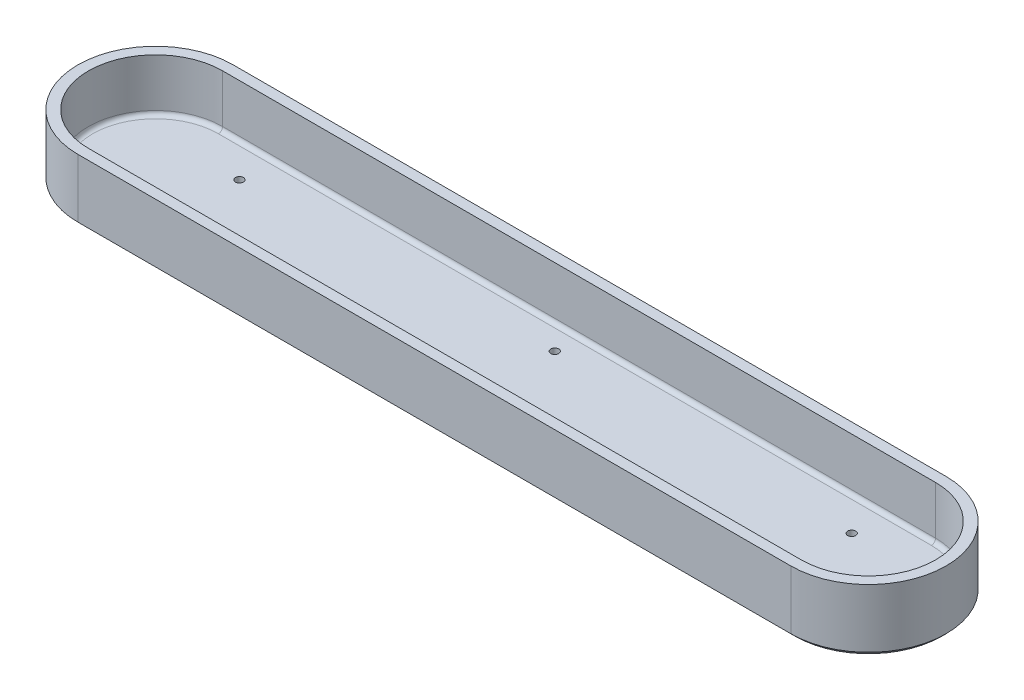
from build123d import *

# Parameters (mm, degrees)
MAINBLOCK_DEPTH     = 3.175
BOSS_EXTRUDE1_DEPTH = 19.05
SKETCH3_R           = 1.2065
CUT_EXTRUDE1_DEPTH  = 135.880337893
FILLET1_R           = 1.27
CHAMFER1_SIZE       = 1.27


with BuildPart() as part:
    # Sketch1 → MainBlock (new body)
    with BuildSketch(Plane(origin=(0, 0, 0), x_dir=(1, 0, 0), z_dir=(0, 1, 0))):
        with BuildLine():
            Line((-107.95, 20.32), (107.95, 20.32))
            ThreePointArc((107.95, 20.32), (128.27, 0), (107.95, -20.32))
            Line((107.95, -20.32), (-107.95, -20.32))
            ThreePointArc((-107.95, -20.32), (-128.27, 0), (-107.95, 20.32))
        make_face()
    extrude(amount=MAINBLOCK_DEPTH)

    # Sketch2 → Boss-Extrude1 (add)
    with BuildSketch(Plane.XZ):
        with BuildLine():
            Line((-107.95, 23.495), (107.95, 23.495))
            ThreePointArc((107.95, 23.495), (131.445, 0), (107.95, -23.495))
            Line((107.95, -23.495), (-107.95, -23.495))
            ThreePointArc((-107.95, -23.495), (-131.445, 0), (-107.95, 23.495))
        make_face()
        with BuildLine():
            Line((107.95, 20.32), (-107.95, 20.32))
            ThreePointArc((-107.95, 20.32), (-128.27, 0), (-107.95, -20.32))
            Line((-107.95, -20.32), (107.95, -20.32))
            ThreePointArc((107.95, -20.32), (128.27, 0), (107.95, 20.32))
        make_face(mode=Mode.SUBTRACT)
    extrude(amount=-BOSS_EXTRUDE1_DEPTH)

    # Sketch3 → Cut-Extrude1 (cut, through all)
    with BuildSketch(Plane.XZ):
        with Locations((0, 12.954)):
            Circle(SKETCH3_R)
        with Locations((-92.71, 10.16)):
            Circle(SKETCH3_R)
        with Locations((92.71, 10.16)):
            Circle(SKETCH3_R)
        with Locations((92.71, -10.16)):
            Circle(SKETCH3_R)
        with Locations((-92.71, -10.16)):
            Circle(SKETCH3_R)
        with Locations((0, -12.954)):
            Circle(SKETCH3_R)
    extrude(amount=-CUT_EXTRUDE1_DEPTH, mode=Mode.SUBTRACT)

    # Fillet1
    fillet1_edges = [part.edges().sort_by_distance(p)[0] for p in [
        (128.27, 3.175, 0),
        (0, 3.175, 20.32),
        (-128.27, 3.175, 0),
        (0, 3.175, -20.32),
    ]]
    fillet(fillet1_edges, radius=FILLET1_R)

    # Chamfer1
    chamfer1_edges = [part.edges().sort_by_distance(p)[0] for p in [
        (0, 0, 23.495),
        (-131.445, 0, 0),
        (131.445, 0, 0),
        (0, 0, -23.495),
    ]]
    chamfer(chamfer1_edges, length=CHAMFER1_SIZE)


solid = part.part
